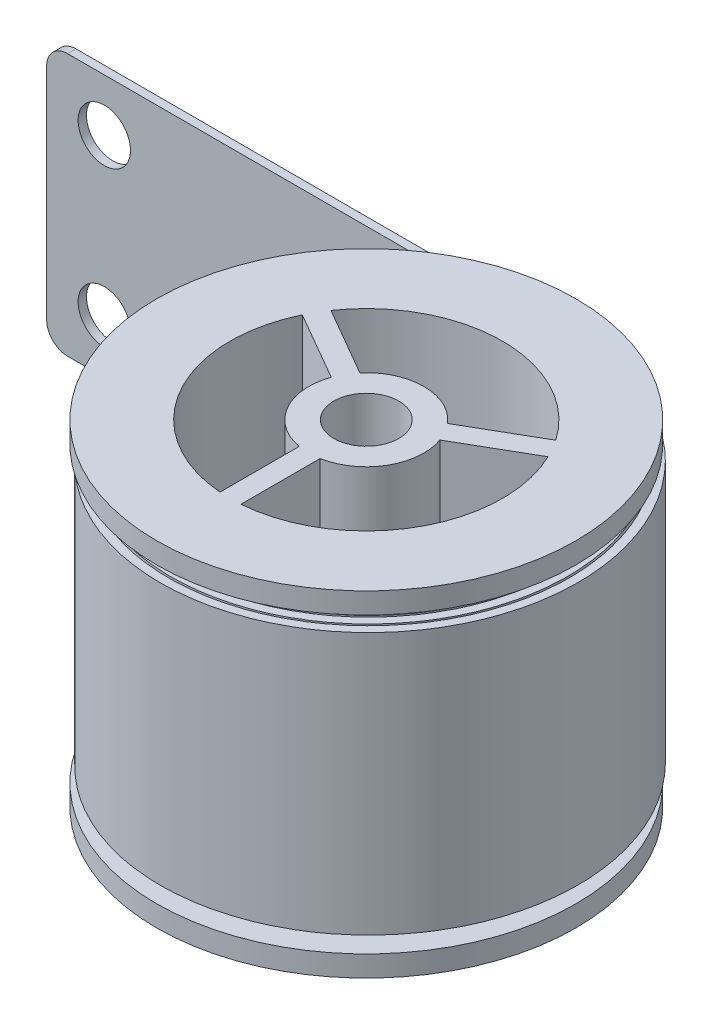
from build123d import *

# Parameters (mm, degrees)
SWEEP_START         = -12.5
SWEEP_1_DEPTH       = 25
SKETCH_5_W          = 0.8
SKETCH_5_H          = 25
EXTRUDE_1_DEPTH     = 50
SKETCH_6_R          = 2.5
CUT_EXTRUDE_1_DEPTH = 0.8
FILLET_1_R          = 2
CUT_EXTRUDE_2_DEPTH = 32


# Read off the part's stored shape, not the designer's step: 扫描1
with BuildPart() as part:
    # 草图2 → 旋转1 (revolve)
    with BuildSketch(Plane.XY, mode=Mode.PRIVATE) as revolve_1_sk:
        Polygon((3.1, -16), (3.1, 16), (20, 16), (20, 14), (16, 14), (16, -14), (20, -14), (20, -16), align=None)
    revolve(revolve_1_sk.sketch.rotate(Axis((0, 16.091889344, 0), (0, -1, 0)), 90), axis=Axis((0, 16.091889344, 0), (0, -1, 0)))

    # 草图7 → 切除-拉伸2 (cut)
    with BuildSketch(Plane.XZ.offset(16)):
        with BuildLine():
            Line((-1, 5.408326913), (-1, 12.961481397))
            ThreePointArc((-1, 12.961481397), (-11.258330249, 6.5), (-11.72497216, -5.614715295))
            Line((-11.72497216, -5.614715295), (-5.183748499, -1.838138053))
            ThreePointArc((-5.183748499, -1.838138053), (-4.763139721, 2.75), (-1, 5.408326913))
        make_face()
        with BuildLine():
            Line((5.183748499, -1.838138053), (11.72497216, -5.614715295))
            ThreePointArc((11.72497216, -5.614715295), (11.258330249, 6.5), (1, 12.961481397))
            Line((1, 12.961481397), (1, 5.408326913))
            ThreePointArc((1, 5.408326913), (4.763139721, 2.75), (5.183748499, -1.838138053))
        make_face()
        with BuildLine():
            Line((-4.183748499, -3.57018886), (-10.72497216, -7.346766102))
            ThreePointArc((-10.72497216, -7.346766102), (0, -13), (10.72497216, -7.346766102))
            Line((10.72497216, -7.346766102), (4.183748499, -3.57018886))
            ThreePointArc((4.183748499, -3.57018886), (0, -5.5), (-4.183748499, -3.57018886))
        make_face()
    extrude(amount=-CUT_EXTRUDE_2_DEPTH, mode=Mode.SUBTRACT)


with BuildPart() as body_2:
    # 扫描1 outline → 扫描1 (new body)
    with BuildSketch(Plane(origin=(0, 0, 0), x_dir=(1, 0, 0), z_dir=(0, 1, 0)).offset(SWEEP_START)):
        with BuildLine():
            add(Edge.make_bspline(
                [(0, 20.3), (0.083579675, 20.300651028), (0.166070818, 20.298186767), (0.332104734, 20.294841601), (0.415107326, 20.292658627), (0.664053409, 20.284580802), (0.829935209, 20.27715705), (1.327185102, 20.248788383), (1.658157688, 20.221746052), (2.648303494, 20.116374931), (3.304704766, 20.01380201), (5.253301361, 19.610270937), (6.52482568, 19.213515783), (8.964286245, 18.180508295), (10.132163007, 17.544283384), (12.319819035, 16.057482323), (13.339545395, 15.206944617), (15.192213226, 13.324814004), (16.025110379, 12.293269053), (17.472721626, 10.08926671), (18.087401665, 8.916864916), (19.07565253, 6.476576151), (19.449200841, 5.208750261), (19.941587983, 2.626564797), (20.060416666, 1.312269423), (20.039583334, -1.312269423), (19.89992389, -2.622448049), (19.368266775, -5.188480719), (18.976284257, -6.444271765), (17.955800055, -8.853498444), (17.327325485, -10.006875338), (15.858705416, -12.167321587), (15.018597914, -13.174338707), (13.159607316, -15.003866523), (12.140771605, -15.826333473), (9.963979041, -17.255763727), (8.806077114, -17.862693425), (6.396022237, -18.838421004), (5.143929619, -19.207196679), (2.593840278, -19.693199505), (1.295906961, -19.810416666), (-1.295906961, -19.789583334), (-2.58972353, -19.651535412), (-5.123660077, -19.126262612), (-6.363717851, -18.739052731), (-8.742710642, -17.731091815), (-9.88158767, -17.110367585), (-12.014824139, -15.65992851), (-13.009132019, -14.830251211), (-14.81551982, -12.994400628), (-15.627556566, -11.988274157), (-17.038805827, -9.838691373), (-17.637985185, -8.695289312), (-18.601189478, -6.315468322), (-18.965192517, -5.079108977), (-19.444811027, -2.561115759), (-19.560416666, -1.279544499), (-19.539583334, 1.279544499), (-19.403146933, 2.556999011), (-18.88425845, 5.058839435), (-18.501821205, 6.283163936), (-17.506383575, 8.63192284), (-16.893409685, 9.756300001), (-15.461151604, 11.862326691), (-14.641904508, 12.843925332), (-12.829193941, 14.627173117), (-11.835776709, 15.42877966), (-9.713403704, 16.821847927), (-8.584501511, 17.413276945), (-6.234914408, 18.363957952), (-5.014288335, 18.723188355), (-2.52839124, 19.196422549), (-1.263182037, 19.310416666), (1.263182037, 19.289583334), (2.524274492, 19.154758455), (4.994018793, 18.642254288), (6.202610021, 18.264589678), (8.521135039, 17.281675335), (9.631012332, 16.676451785), (11.709829243, 15.262374697), (12.678718644, 14.453557805), (14.438826415, 12.663987253), (15.230002754, 11.683279261), (16.604890027, 9.588116036), (17.188568704, 8.473713709), (18.126726426, 6.154360493), (18.481184192, 4.949467693), (18.948034071, 2.495666721), (19.060416666, 1.246819576), (19.039583334, -1.246819576), (18.906369977, -2.491549973), (18.400250126, -4.92919815), (18.027358152, -6.122056107), (17.056967095, -8.410347237), (16.459493886, -9.505724664), (15.063597791, -11.557331795), (14.265211102, -12.513511956), (12.498780566, -14.250479712), (11.530781813, -15.031225847), (9.462828367, -16.387932128), (8.362925908, -16.963860464), (6.073806578, -17.8894949), (4.88464705, -18.23918003), (2.462942203, -18.699645593), (1.230457114, -18.810416666), (-1.230457114, -18.789583334), (-2.458825454, -18.657981499), (-4.864377508, -18.158245964), (-6.041502192, -17.790126626), (-8.299559436, -16.832258855), (-9.380436995, -16.242535986), (-11.404834347, -14.864820884), (-12.348305269, -14.076864399), (-14.062133009, -12.333573878), (-14.832448941, -11.378284365), (-16.170974228, -9.337540699), (-16.739152224, -8.252138106), (-17.652263374, -5.993252664), (-17.997175868, -4.819826408), (-18.451257115, -2.430217684), (-18.560416666, -1.214094652), (-18.539583334, 1.214094652), (-18.409593021, 2.426100936), (-17.916241802, 4.799556866), (-17.5528951, 5.960948278), (-16.607550615, 8.188771634), (-16.025578086, 9.255149327), (-14.666043978, 11.252336899), (-13.888517696, 12.183098581), (-12.16836719, 13.873786306), (-11.225786917, 14.633672034), (-9.21225303, 15.954016328), (-8.141350304, 16.514443984), (-5.912698749, 17.415031847), (-4.755005766, 17.755171706), (-2.397493165, 18.202868637), (-1.19773219, 18.310416666), (1.19773219, 18.289583334), (2.393376417, 18.161204543), (4.734736224, 17.674237639), (5.880394363, 17.315663574), (8.077983832, 16.382842374), (9.129861658, 15.808620186), (11.099839451, 14.467267072), (12.017891893, 13.700170993), (13.685439603, 12.003160503), (14.434895128, 11.073289469), (15.737058428, 9.086965362), (16.289735744, 8.030562503), (17.177800321, 5.832144835), (17.513167544, 4.690185124), (17.954480159, 2.364768646), (18.060416666, 1.181369729), (18.039583334, -1.181369729), (17.912816065, -2.360651898), (17.432233477, -4.669915582), (17.078432048, -5.799840449), (16.158134134, -7.967196031), (15.591662287, -9.00457399), (14.268490165, -10.947342004), (13.51182429, -11.852685206), (11.837953815, -13.4970929), (10.920792021, -14.236118222), (8.961677693, -15.520100529), (7.919774701, -16.065027504), (5.75159092, -16.940568795), (4.625364482, -17.271163382), (2.332044127, -17.706091681), (1.165007267, -17.810416666), (-1.165007267, -17.789583334), (-2.327927379, -17.664427587), (-4.60509494, -17.190229315), (-5.719286534, -16.841200522), (-7.856408229, -15.933425894), (-8.879286321, -15.374704387), (-10.794844556, -14.069713259), (-11.687478518, -13.323477588), (-13.308746197, -11.672747127), (-14.037341315, -10.768294573), (-15.303142629, -8.836390025), (-15.840319264, -7.8089869), (-16.703337269, -5.671037005), (-17.029159219, -4.56054384), (-17.457703203, -2.299319608), (-17.560416666, -1.148644805), (-17.539583334, 1.148644805), (-17.416039109, 2.29520286), (-16.948225153, 4.540274298), (-16.603968995, 5.638732619), (-15.708717654, 7.745620428), (-15.157746487, 8.753998653), (-13.870936353, 10.642347108), (-13.135130885, 11.52227183), (-11.50754044, 13.120399494), (-10.615797125, 13.838564409), (-8.711102356, 15.086184729), (-7.698199098, 15.615611024), (-5.590483091, 16.466105743), (-4.495723198, 16.787155057), (-2.266595089, 17.209314725), (-1.132282343, 17.310416666), (1.132282343, 17.289583334), (2.262478341, 17.167650631), (4.475453655, 16.706220991), (5.558178705, 16.366737469), (7.634832626, 15.484009414), (8.628710984, 14.940788587), (10.48984966, 13.672159446), (11.357065143, 12.946784182), (12.932052791, 11.342333752), (13.639787502, 10.463299677), (14.869226829, 8.585814688), (15.390902784, 7.587411296), (16.228874217, 5.509929176), (16.545150895, 4.430902555), (16.960926247, 2.23387057), (17.060416666, 1.115919882), (17.039583334, -1.115919882), (16.919262153, -2.229753822), (16.464216829, -4.410633013), (16.129505943, -5.47762479), (15.259301174, -7.524044824), (14.723830687, -8.503423316), (13.47338254, -10.337352212), (12.758437479, -11.191858455), (11.177127065, -12.743706088), (10.310802229, -13.441010596), (8.460527019, -14.65226893), (7.476623495, -15.166194543), (5.429375262, -15.99164269), (4.366081913, -16.303146733), (2.201146052, -16.712537769), (1.09955742, -16.810416666), (0, -16.8)],
                knots=[0, 0, 0, 0, 0.000488281, 0.000488281, 0.000976562, 0.000976562, 0.001953125, 0.001953125, 0.00390625, 0.00390625, 0.0078125, 0.0078125, 0.015625, 0.015625, 0.0234375, 0.0234375, 0.03125, 0.03125, 0.0390625, 0.0390625, 0.046875, 0.046875, 0.0546875, 0.0546875, 0.0625, 0.0625, 0.0703125, 0.0703125, 0.078125, 0.078125, 0.0859375, 0.0859375, 0.09375, 0.09375, 0.1015625, 0.1015625, 0.109375, 0.109375, 0.1171875, 0.1171875, 0.125, 0.125, 0.1328125, 0.1328125, 0.140625, 0.140625, 0.1484375, 0.1484375, 0.15625, 0.15625, 0.1640625, 0.1640625, 0.171875, 0.171875, 0.1796875, 0.1796875, 0.1875, 0.1875, 0.1953125, 0.1953125, 0.203125, 0.203125, 0.2109375, 0.2109375, 0.21875, 0.21875, 0.2265625, 0.2265625, 0.234375, 0.234375, 0.2421875, 0.2421875, 0.25, 0.25, 0.2578125, 0.2578125, 0.265625, 0.265625, 0.2734375, 0.2734375, 0.28125, 0.28125, 0.2890625, 0.2890625, 0.296875, 0.296875, 0.3046875, 0.3046875, 0.3125, 0.3125, 0.3203125, 0.3203125, 0.328125, 0.328125, 0.3359375, 0.3359375, 0.34375, 0.34375, 0.3515625, 0.3515625, 0.359375, 0.359375, 0.3671875, 0.3671875, 0.375, 0.375, 0.3828125, 0.3828125, 0.390625, 0.390625, 0.3984375, 0.3984375, 0.40625, 0.40625, 0.4140625, 0.4140625, 0.421875, 0.421875, 0.4296875, 0.4296875, 0.4375, 0.4375, 0.4453125, 0.4453125, 0.453125, 0.453125, 0.4609375, 0.4609375, 0.46875, 0.46875, 0.4765625, 0.4765625, 0.484375, 0.484375, 0.4921875, 0.4921875, 0.5, 0.5, 0.5078125, 0.5078125, 0.515625, 0.515625, 0.5234375, 0.5234375, 0.53125, 0.53125, 0.5390625, 0.5390625, 0.546875, 0.546875, 0.5546875, 0.5546875, 0.5625, 0.5625, 0.5703125, 0.5703125, 0.578125, 0.578125, 0.5859375, 0.5859375, 0.59375, 0.59375, 0.6015625, 0.6015625, 0.609375, 0.609375, 0.6171875, 0.6171875, 0.625, 0.625, 0.6328125, 0.6328125, 0.640625, 0.640625, 0.6484375, 0.6484375, 0.65625, 0.65625, 0.6640625, 0.6640625, 0.671875, 0.671875, 0.6796875, 0.6796875, 0.6875, 0.6875, 0.6953125, 0.6953125, 0.703125, 0.703125, 0.7109375, 0.7109375, 0.71875, 0.71875, 0.7265625, 0.7265625, 0.734375, 0.734375, 0.7421875, 0.7421875, 0.75, 0.75, 0.7578125, 0.7578125, 0.765625, 0.765625, 0.7734375, 0.7734375, 0.78125, 0.78125, 0.7890625, 0.7890625, 0.796875, 0.796875, 0.8046875, 0.8046875, 0.8125, 0.8125, 0.8203125, 0.8203125, 0.828125, 0.828125, 0.8359375, 0.8359375, 0.84375, 0.84375, 0.8515625, 0.8515625, 0.859375, 0.859375, 0.8671875, 0.8671875, 0.875, 0.875, 0.875, 0.875], degree=3))
            Line((0, 20.3), (0, 19.5))
            add(Edge.make_bspline(
                [(0, 19.5), (0.080296532, 19.500651028), (0.159506481, 19.498206977), (0.318981927, 19.494942516), (0.398707242, 19.492820036), (0.63782739, 19.484983946), (0.797166427, 19.477801676), (1.274811669, 19.450397341), (1.592746009, 19.424317603), (2.543871349, 19.3227899), (3.174383574, 19.224051257), (5.045698521, 18.83589343), (6.267192492, 18.454315807), (8.609590152, 17.461515844), (9.731359164, 16.849937834), (11.831662116, 15.421508828), (12.810975441, 14.604140113), (14.589357377, 12.796302613), (15.389089457, 11.805173926), (16.778337116, 9.688530365), (17.368374722, 8.562238743), (18.316427476, 6.21901687), (18.674803111, 5.001222854), (19.146702613, 2.522081703), (19.260411535, 1.259816971), (19.239588472, -1.259660569), (19.105058962, -2.517809544), (18.593909644, -4.98080187), (18.217109594, -6.186563978), (17.236842526, -8.498731557), (16.633019438, -9.606003057), (15.222780134, -11.679101854), (14.41584567, -12.645709152), (12.631155653, -14.40095831), (11.652739558, -15.19026414), (9.563311707, -16.561339388), (8.451522478, -17.143631198), (6.138538646, -18.07917027), (4.936479499, -18.432778236), (2.489436679, -18.898303684), (1.243534603, -19.010406282), (-1.243217849, -18.989593749), (-2.485005196, -18.856680991), (-4.915903297, -18.351926381), (-6.105933579, -17.97990403), (-8.387871172, -17.012170101), (-9.480645218, -16.416102051), (-11.526540003, -15.02405267), (-12.480441354, -14.227552561), (-14.212557919, -12.466010216), (-14.991437597, -11.5003068), (-16.344340653, -9.438094811), (-16.918886783, -8.340808039), (-17.841912418, -6.058062356), (-18.19075284, -4.871738119), (-18.649904497, -2.456793688), (-18.760400904, -1.227254282), (-18.739599169, 1.226773076), (-18.608303298, 2.452198805), (-18.109943661, 4.851002729), (-17.74269914, 6.025301221), (-16.787498602, 8.277008928), (-16.199185712, 9.355285581), (-14.825326485, 11.3739765), (-14.039260836, 12.31517199), (-12.300866363, 14.024156151), (-11.347875714, 14.792609783), (-9.312879744, 16.127340871), (-8.230095497, 16.694141441), (-5.977588075, 17.604653894), (-4.806998789, 17.948726903), (-2.424152807, 18.401505041), (-1.210976089, 18.510395394), (1.210326171, 18.489604738), (2.419390292, 18.359925893), (4.786100089, 17.867961507), (5.944666828, 17.505494949), (8.166144752, 16.562828067), (9.229924076, 15.982270461), (11.221411283, 14.626601628), (12.149900998, 13.850970551), (13.835752953, 12.135724154), (14.593780646, 11.195446366), (15.910340004, 9.187666579), (16.469395138, 8.119384927), (17.367394671, 5.89711588), (17.706700405, 4.742261591), (18.153105306, 2.39151412), (18.26038975, 1.194700107), (18.239610462, -1.193877048), (18.111548788, -2.386579574), (17.625979941, -4.721195294), (17.268291487, -5.86403032), (16.338158533, -8.055278567), (15.765356344, -9.104560629), (14.427878151, -11.068844283), (13.662681762, -11.984628315), (11.970583656, -13.647348269), (11.043018825, -14.394950136), (9.062455392, -15.693338006), (8.008676407, -16.244647836), (5.816645856, -17.130134724), (4.67752661, -17.464673324), (2.358877715, -17.904705282), (1.178426424, -18.010383965), (-1.177425621, -17.989616348), (-2.353766562, -17.863171996), (-4.656288259, -17.383998986), (-5.783391613, -17.031088783), (-7.944410295, -16.113490041), (-8.979195163, -15.548443404), (-10.916275429, -14.229156111), (-11.819353872, -13.474394531), (-13.45894204, -11.805444938), (-14.196118197, -10.890593163), (-15.476334835, -8.937246261), (-16.019899493, -7.89797002), (-16.892874021, -5.73617809), (-17.222645636, -4.612793935), (-17.656304957, -2.326243683), (-17.760378034, -1.162155133), (-17.739622404, 1.160971794), (-17.614795529, 2.320951164), (-17.142018668, 4.591378893), (-16.793886867, 5.702750617), (-15.888822635, 7.833539849), (-15.33153169, 8.853827596), (-14.030435567, 10.763704646), (-13.28610892, 11.654077599), (-11.640308072, 13.270534202), (-10.738169458, 13.997284772), (-8.812039272, 15.259330441), (-7.787265853, 15.795150069), (-5.655712674, 16.655612535), (-4.54806366, 16.980617317), (-2.293612121, 17.40790432), (-1.145886332, 17.510371952), (1.144515471, 17.489628635), (2.288133281, 17.366419401), (4.5264671, 16.900039014), (5.622107239, 16.556685773), (7.722667142, 15.664156358), (8.728457842, 15.114621254), (10.611131854, 13.83171658), (11.48879942, 13.097824998), (13.08212469, 11.475173135), (13.798449799, 10.58574779), (15.042324775, 8.686834513), (15.570399518, 7.676563998), (16.418350231, 5.575249706), (16.738588341, 4.483335886), (17.159503357, 2.260983133), (17.260365713, 1.129620124), (17.239635051, -1.128056548), (17.118043627, -2.255312811), (16.658060051, -4.461552779), (16.319485535, -5.541461379), (15.439491258, -7.611792078), (14.897712148, -8.603085809), (13.632999216, -10.458556971), (12.909542834, -11.323519256), (11.310040209, -12.893713434), (10.433328246, -13.599613213), (8.561632078, -14.825317784), (7.565864553, -15.345647795), (5.494789289, -16.181087076), (4.418610717, -16.496558682), (2.228356827, -16.911102056), (1.11335662, -17.010359311), (-1.111594914, -16.989641659), (-2.222489644, -16.869668223), (-4.396635824, -16.416081809), (-5.460812934, -16.08228619), (-7.500914558, -15.214827387), (-8.477711402, -14.68080443), (-10.305979907, -13.434283544), (-11.158237023, -12.721262503), (-12.70530036, -11.144909378), (-13.400774948, -10.280910916), (-14.608309411, -8.436432065), (-15.120894849, -7.45516762), (-15.943823036, -5.414331531), (-16.25452831, -4.353888265), (-16.662700402, -2.195733317), (-16.760352739, -1.097095933), (-16.739648468, 1.095130454), (-16.621293204, 2.189663665), (-16.17410432, 4.331716123), (-15.845087777, 5.380161791), (-14.990164796, 7.390034478), (-14.463898159, 8.352334518), (-13.235569637, 10.15340057), (-12.532984086, 10.992952632), (-10.979780733, 12.51688539), (-10.128495894, 13.20193493), (-8.31123458, 14.391299599), (-7.344473307, 14.896140629), (-5.333876548, 15.70655807), (-4.289168647, 16.012497195), (-2.163112724, 16.414298382), (-1.080838187, 16.510345991), (1.078663046, 16.489655488), (2.156834753, 16.372918587), (4.266793555, 15.932127617), (5.299507835, 15.607890336), (7.279151726, 14.765503542), (8.226955051, 14.2469934), (10.00081886, 13.036857573), (10.82766599, 12.344707666), (12.328468443, 10.814654371), (13.003093084, 9.976083284), (14.174288284, 8.186039734), (14.671385078, 7.233781731), (15.469292141, 5.253424462), (15.770465306, 4.224451988), (16.165895978, 2.130495177), (16.260339059, 1.06458351), (16.239662728, -1.062192559), (16.124544392, -2.124002777), (15.690151735, -4.201867994), (15.370693912, -5.21885094), (14.540843685, -7.168266184), (14.030090219, -8.101572886), (12.838147433, -9.848234674), (12.156433331, -10.662376997), (10.649530393, -12.14004943), (9.823673192, -12.804249329), (8.060847644, -13.957275399), (7.123093012, -14.44662814), (5.172975402, -15.232025205), (4.159738419, -15.528432608), (2.097880811, -15.917493176), (1.048332041, -16.010331936), (0.001306592, -16.000001067)],
                knots=[0, 0, 0, 0, 0.000488281, 0.000488281, 0.000976562, 0.000976562, 0.001953125, 0.001953125, 0.00390625, 0.00390625, 0.0078125, 0.0078125, 0.015625, 0.015625, 0.0234375, 0.0234375, 0.03125, 0.03125, 0.0390625, 0.0390625, 0.046875, 0.046875, 0.0546875, 0.0546875, 0.0625, 0.0625, 0.0703125, 0.0703125, 0.078125, 0.078125, 0.0859375, 0.0859375, 0.09375, 0.09375, 0.1015625, 0.1015625, 0.109375, 0.109375, 0.1171875, 0.1171875, 0.125, 0.125, 0.1328125, 0.1328125, 0.140625, 0.140625, 0.1484375, 0.1484375, 0.15625, 0.15625, 0.1640625, 0.1640625, 0.171875, 0.171875, 0.1796875, 0.1796875, 0.1875, 0.1875, 0.1953125, 0.1953125, 0.203125, 0.203125, 0.2109375, 0.2109375, 0.21875, 0.21875, 0.2265625, 0.2265625, 0.234375, 0.234375, 0.2421875, 0.2421875, 0.25, 0.25, 0.2578125, 0.2578125, 0.265625, 0.265625, 0.2734375, 0.2734375, 0.28125, 0.28125, 0.2890625, 0.2890625, 0.296875, 0.296875, 0.3046875, 0.3046875, 0.3125, 0.3125, 0.3203125, 0.3203125, 0.328125, 0.328125, 0.3359375, 0.3359375, 0.34375, 0.34375, 0.3515625, 0.3515625, 0.359375, 0.359375, 0.3671875, 0.3671875, 0.375, 0.375, 0.3828125, 0.3828125, 0.390625, 0.390625, 0.3984375, 0.3984375, 0.40625, 0.40625, 0.4140625, 0.4140625, 0.421875, 0.421875, 0.4296875, 0.4296875, 0.4375, 0.4375, 0.4453125, 0.4453125, 0.453125, 0.453125, 0.4609375, 0.4609375, 0.46875, 0.46875, 0.4765625, 0.4765625, 0.484375, 0.484375, 0.4921875, 0.4921875, 0.5, 0.5, 0.5078125, 0.5078125, 0.515625, 0.515625, 0.5234375, 0.5234375, 0.53125, 0.53125, 0.5390625, 0.5390625, 0.546875, 0.546875, 0.5546875, 0.5546875, 0.5625, 0.5625, 0.5703125, 0.5703125, 0.578125, 0.578125, 0.5859375, 0.5859375, 0.59375, 0.59375, 0.6015625, 0.6015625, 0.609375, 0.609375, 0.6171875, 0.6171875, 0.625, 0.625, 0.6328125, 0.6328125, 0.640625, 0.640625, 0.6484375, 0.6484375, 0.65625, 0.65625, 0.6640625, 0.6640625, 0.671875, 0.671875, 0.6796875, 0.6796875, 0.6875, 0.6875, 0.6953125, 0.6953125, 0.703125, 0.703125, 0.7109375, 0.7109375, 0.71875, 0.71875, 0.7265625, 0.7265625, 0.734375, 0.734375, 0.7421875, 0.7421875, 0.75, 0.75, 0.7578125, 0.7578125, 0.765625, 0.765625, 0.7734375, 0.7734375, 0.78125, 0.78125, 0.7890625, 0.7890625, 0.796875, 0.796875, 0.8046875, 0.8046875, 0.8125, 0.8125, 0.8203125, 0.8203125, 0.828125, 0.828125, 0.8359375, 0.8359375, 0.84375, 0.84375, 0.8515625, 0.8515625, 0.859375, 0.859375, 0.8671875, 0.8671875, 0.875, 0.875, 0.875, 0.875], degree=3))
            Line((0.001306592, -16.000001067), (0, -16.8))
        make_face()
    extrude(amount=SWEEP_1_DEPTH)

    # 草图5 → 凸台-拉伸1 (add)
    with BuildSketch(Plane.ZY):
        with Locations((-19.9, 0)):
            Rectangle(SKETCH_5_W, SKETCH_5_H)
    extrude(amount=EXTRUDE_1_DEPTH)

    # 草图6 → 切除-拉伸1 (cut)
    with BuildSketch(Plane(origin=(0, 0, -20.3), x_dir=(-1, 0, 0), z_dir=(0, 0, -1))):
        with Locations((44.5, 7.5)):
            Circle(SKETCH_6_R)
        with Locations((44.5, -7.5)):
            Circle(SKETCH_6_R)
    extrude(amount=-CUT_EXTRUDE_1_DEPTH, mode=Mode.SUBTRACT)

    # 圆角1
    fillet_1_edges = [body_2.edges().sort_by_distance(p)[0] for p in [
        (-50, -12.5, -19.9),
        (-50, 12.5, -19.9),
    ]]
    fillet(fillet_1_edges, radius=FILLET_1_R)


solid = Compound([part.part, body_2.part])
